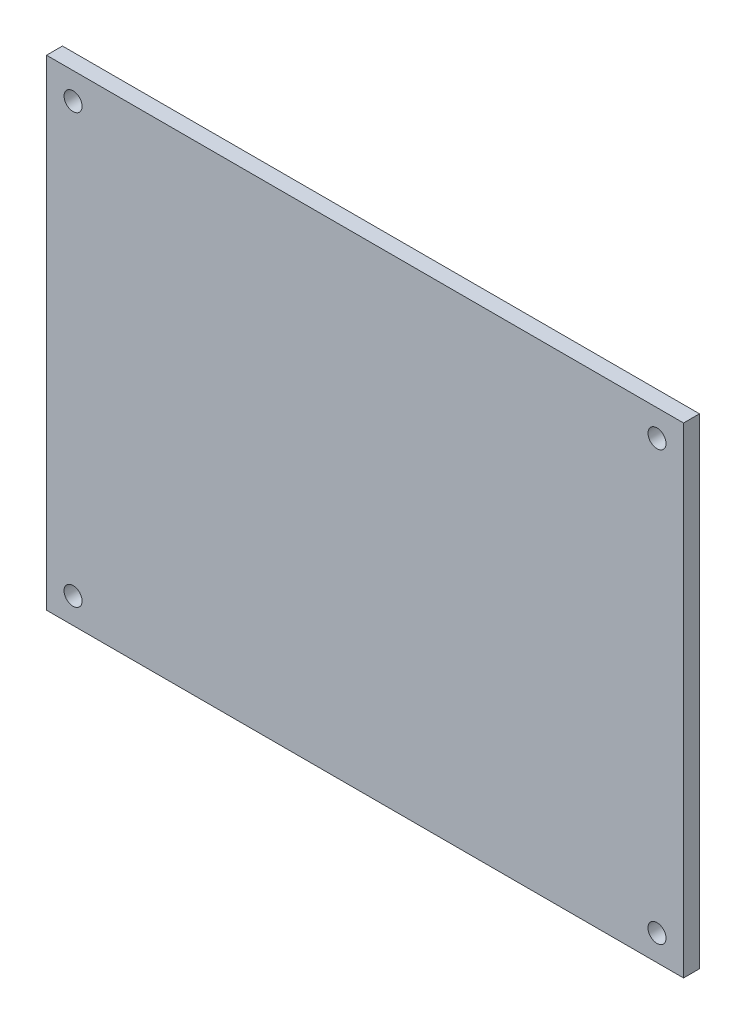
from build123d import *

# Parameters (mm, degrees)
SKETCH1_W                    = 120
SKETCH1_H                    = 90.54407714
BOSS_EXTRUDE1_DEPTH          = 3
M3_CLEARANCE_HOLE1_OUTLINE_R = 1.7
M3_CLEARANCE_HOLE1_DEPTH     = 3


# Read off the part's stored shape, not the designer's step: M3 Clearance Hole1
with BuildPart() as part:
    # Sketch1 → Boss-Extrude1 (new body)
    with BuildSketch(Plane.XY):
        with Locations((60, 45.27203857)):
            Rectangle(SKETCH1_W, SKETCH1_H)
    extrude(amount=BOSS_EXTRUDE1_DEPTH)

    # M3 Clearance Hole1 outline → M3 Clearance Hole1 (cut)
    with BuildSketch(Plane.XY):
        with Locations((115, 85.54407714)):
            Circle(M3_CLEARANCE_HOLE1_OUTLINE_R)
        with Locations((5, 4.837006433)):
            Circle(M3_CLEARANCE_HOLE1_OUTLINE_R)
        with Locations((115, 4.837006433)):
            Circle(M3_CLEARANCE_HOLE1_OUTLINE_R)
        with Locations((5, 85.54407714)):
            Circle(M3_CLEARANCE_HOLE1_OUTLINE_R)
    extrude(amount=M3_CLEARANCE_HOLE1_DEPTH, mode=Mode.SUBTRACT)


solid = part.part
